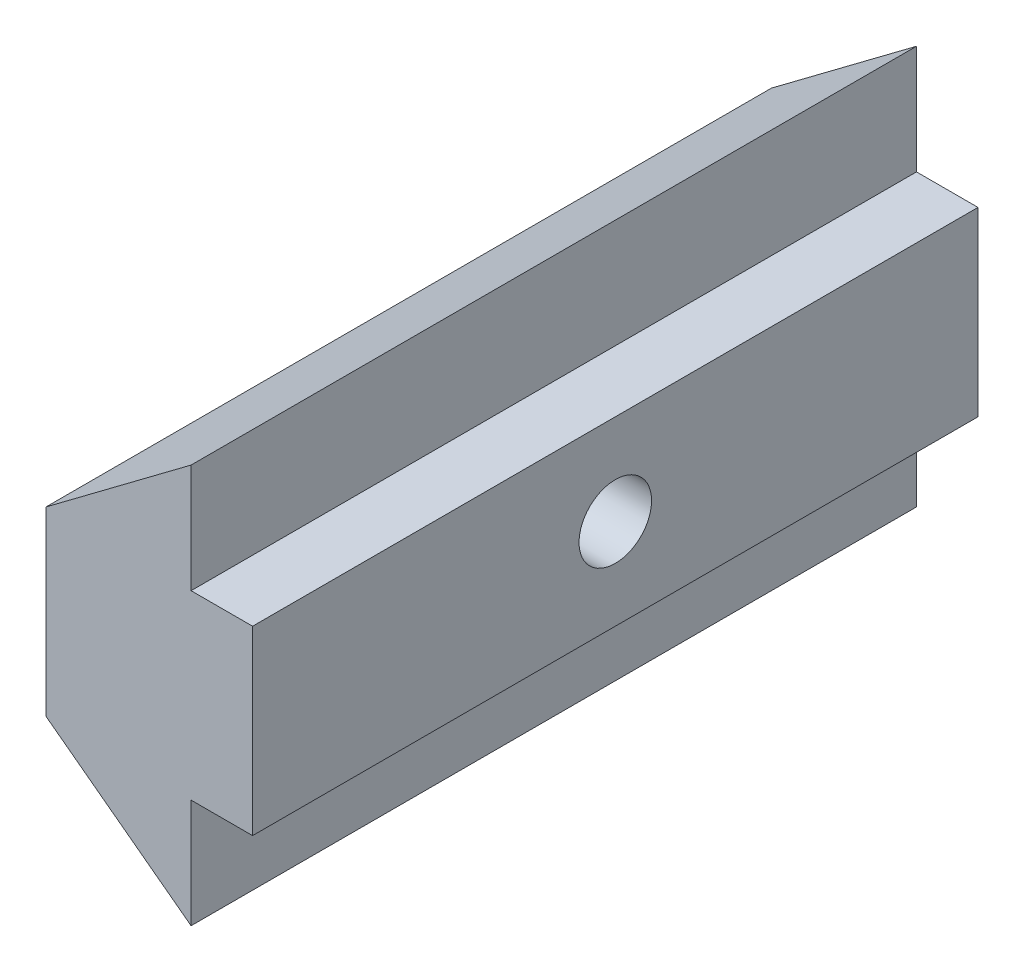
from build123d import *

# Parameters (mm, degrees)
BOSS_EXTRU_1_DEPTH      = 20
ESQUISSE1_R             = 1
ENL_V_MAT_EXTRU_1_DEPTH = 23.280992047


with BuildPart() as part:
    # ProfileRainureEsquisse → Boss.-Extru.1 (new body)
    with BuildSketch(Plane.XY):
        Polygon((0, 0), (0, 5), (4, 8), (4, 5), (5.695841166, 5), (5.695841166, 0), (4, 0), (4, -3), align=None)
    extrude(amount=BOSS_EXTRU_1_DEPTH)

    # Esquisse1 → Enlèv. mat.-Extru.1 (cut, through all)
    with BuildSketch(Plane(origin=(5.695841166, 0, 0), x_dir=(0, 0, -1), z_dir=(1, 0, 0))):
        with Locations((-10, 2.5)):
            Circle(ESQUISSE1_R)
    extrude(amount=-ENL_V_MAT_EXTRU_1_DEPTH, mode=Mode.SUBTRACT)


solid = part.part
